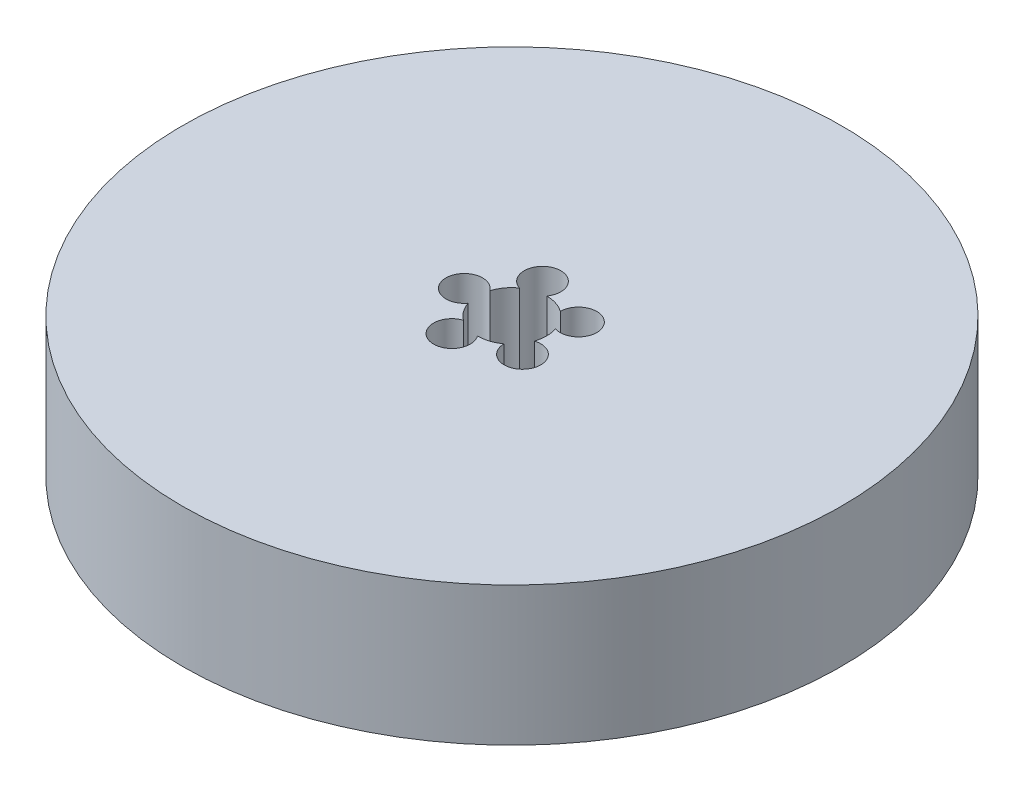
from build123d import *

# Parameters (mm, degrees)
SKETCH1_R           = 47.5
BOSS_EXTRUDE1_DEPTH = 20
SKETCH2_R           = 5
CUT_EXTRUDE1_DEPTH  = 71.089228844
SKETCH3_R           = 2.638970748
CUT_EXTRUDE2_DEPTH  = 15.757622086
CIRPATTERN1_COUNT   = 5


with BuildPart() as part:
    # Sketch1 → Boss-Extrude1 (new body)
    with BuildSketch(Plane(origin=(0, 0, 0), x_dir=(1, 0, 0), z_dir=(0, 1, 0))):
        Circle(SKETCH1_R)
    extrude(amount=BOSS_EXTRUDE1_DEPTH)

    # Sketch2 → Cut-Extrude1 (cut, through all)
    with BuildSketch(Plane(origin=(0, 0, 0), x_dir=(1, 0, 0), z_dir=(0, 1, 0))):
        Circle(SKETCH2_R)
    extrude(amount=CUT_EXTRUDE1_DEPTH, mode=Mode.SUBTRACT)

    # Sketch3 → Cut-Extrude2 (cut)
    with BuildSketch(Plane(origin=(0, 20, 0), x_dir=(1, 0, 0), z_dir=(0, 1, 0))):
        with Locations((-6.865243739, 0)):
            Circle(SKETCH3_R)
    cut_extrude2 = extrude(amount=-CUT_EXTRUDE2_DEPTH, mode=Mode.SUBTRACT)

    # CirPattern1: Cut-Extrude2 ×5 about axis
    cirpattern1_axis = Axis((0, 0, 0), (0, 1, 0))
    for i in range(1, CIRPATTERN1_COUNT):
        add(cut_extrude2.rotate(cirpattern1_axis, i * 360 / CIRPATTERN1_COUNT), mode=Mode.SUBTRACT)


solid = part.part
